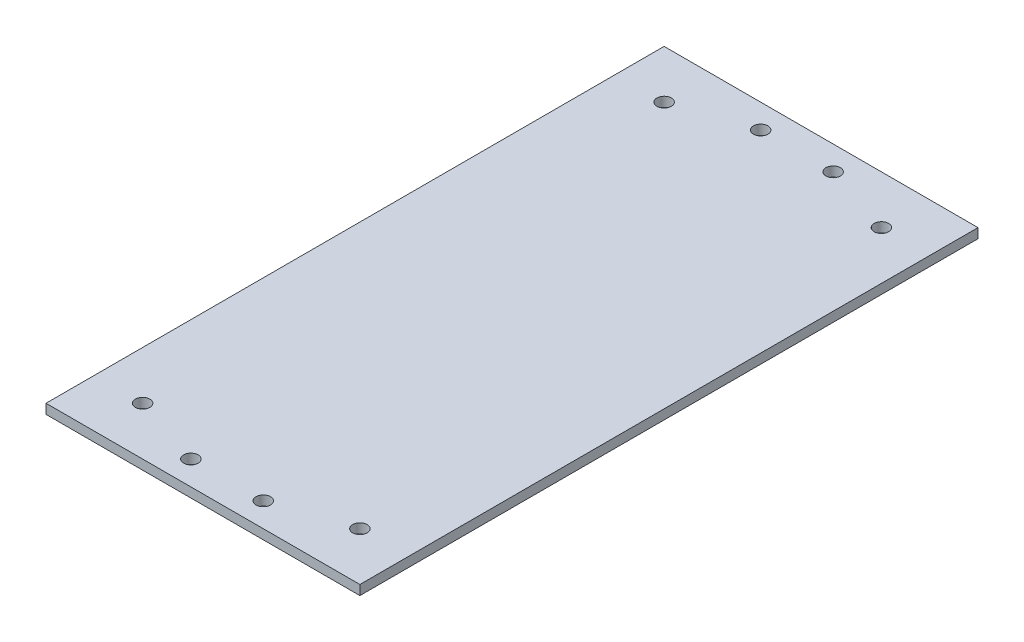
from build123d import *

# Parameters (mm, degrees)
SKETCH_1_W          = 65
SKETCH_1_H          = 128
SKETCH_1_R          = 1.5
EXTRUDE_1_DEPTH     = 2
SKETCH_2_R          = 1.5
CUT_EXTRUDE_1_DEPTH = 106.177758243


with BuildPart() as part:
    # Эскиз1 → Бобышка-Вытянуть1 (new body)
    with BuildSketch(Plane(origin=(0, 0, 0), x_dir=(1, 0, 0), z_dir=(0, 1, 0))):
        with Locations((-41.85845893, -10.35845893)):
            Rectangle(SKETCH_1_W, SKETCH_1_H)
        with Locations((-64.35845893, 43.64154107)):
            Circle(SKETCH_1_R, mode=Mode.SUBTRACT)
        with Locations((-19.35845893, 43.64154107)):
            Circle(SKETCH_1_R, mode=Mode.SUBTRACT)
        with Locations((-19.35845893, -64.35845893)):
            Circle(SKETCH_1_R, mode=Mode.SUBTRACT)
        with Locations((-64.35845893, -64.35845893)):
            Circle(SKETCH_1_R, mode=Mode.SUBTRACT)
    extrude(amount=EXTRUDE_1_DEPTH)

    # Эскиз2 → Вырез-Вытянуть1 (cut, through all)
    with BuildSketch(Plane(origin=(0, 2, 0), x_dir=(1, 0, 0), z_dir=(0, 1, 0))):
        with Locations((-49.35845893, 48.64154107)):
            Circle(SKETCH_2_R)
        with Locations((-34.35845893, 48.64154107)):
            Circle(SKETCH_2_R)
        with Locations((-34.35845893, -69.35845893)):
            Circle(SKETCH_2_R)
        with Locations((-49.35845893, -69.35845893)):
            Circle(SKETCH_2_R)
    extrude(amount=-CUT_EXTRUDE_1_DEPTH, mode=Mode.SUBTRACT)


solid = part.part
